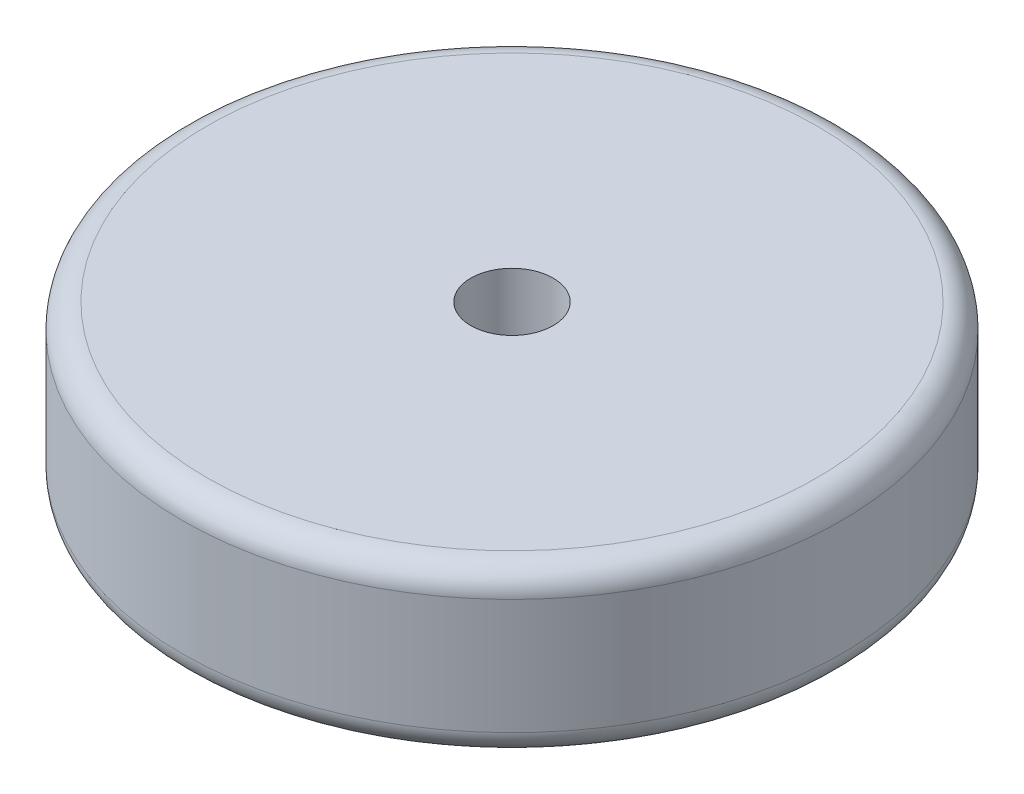
from build123d import *

# Parameters (mm, degrees)
SKETCH_1_R      = 40
SKETCH_1_R_2    = 5
EXTRUDE_1_DEPTH = 20
FILLET_1_R      = 3


with BuildPart() as part:
    # 草圖1 → 填料-伸長1 (new body)
    with BuildSketch(Plane(origin=(0, 0, 0), x_dir=(1, 0, 0), z_dir=(0, 1, 0))):
        Circle(SKETCH_1_R)
        Circle(SKETCH_1_R_2, mode=Mode.SUBTRACT)
    extrude(amount=EXTRUDE_1_DEPTH)

    # 圓角1
    fillet_1_edges = [part.edges().sort_by_distance(p)[0] for p in [
        (-40, 0, 0),
        (-40, 20, 0),
    ]]
    fillet(fillet_1_edges, radius=FILLET_1_R)


solid = part.part
